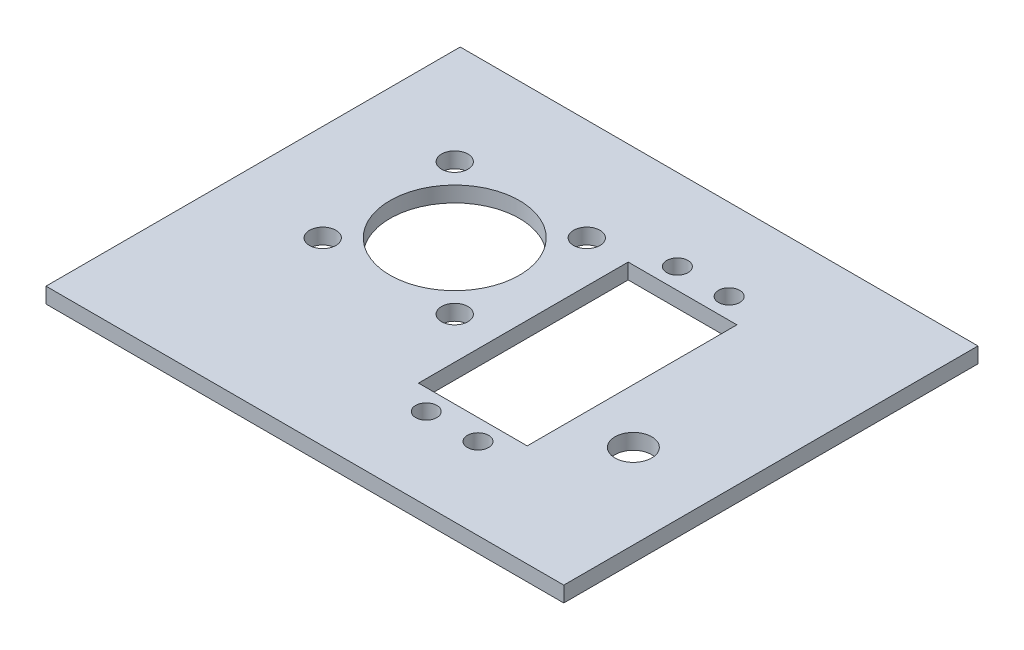
from build123d import *

# Parameters (mm, degrees)
SZKIC1_W                    = 100
SZKIC1_H                    = 80
SZKIC1_R                    = 2.55
SZKIC1_R_2                  = 2.05
SZKIC1_R_3                  = 3.55
SZKIC1_R_4                  = 12.5
SZKIC1_W_2                  = 21
SZKIC1_H_2                  = 40.5
DODANIE_WYCI_GNI_CIE1_DEPTH = 3


with BuildPart() as part:
    # Szkic1 → Dodanie-wyciągnięcie1 (new body)
    with BuildSketch(Plane(origin=(0, 0, 0), x_dir=(1, 0, 0), z_dir=(0, 1, 0))):
        with Locations((11.336719097, -8.838965942)):
            Rectangle(SZKIC1_W, SZKIC1_H)
        with Locations((-20.018770099, -14.043104788)):
            Circle(SZKIC1_R, mode=Mode.SUBTRACT)
        with Locations((5.481229901, -14.043104788)):
            Circle(SZKIC1_R, mode=Mode.SUBTRACT)
        with Locations((19.025116298, -33.088965942)):
            Circle(SZKIC1_R_2, mode=Mode.SUBTRACT)
        with Locations((29.025116298, -33.088965942)):
            Circle(SZKIC1_R_2, mode=Mode.SUBTRACT)
        with Locations((45.025116298, -19.088965942)):
            Circle(SZKIC1_R_3, mode=Mode.SUBTRACT)
        with Locations((-7.268770099, -1.293104788)):
            Circle(SZKIC1_R_4, mode=Mode.SUBTRACT)
        with Locations((-20.018770099, 11.456895212)):
            Circle(SZKIC1_R, mode=Mode.SUBTRACT)
        with Locations((5.481229901, 11.456895212)):
            Circle(SZKIC1_R, mode=Mode.SUBTRACT)
        with Locations((24.025116298, -8.838965942)):
            Rectangle(SZKIC1_W_2, SZKIC1_H_2, mode=Mode.SUBTRACT)
        with Locations((19.025116298, 15.411034058)):
            Circle(SZKIC1_R_2, mode=Mode.SUBTRACT)
        with Locations((29.025116298, 15.411034058)):
            Circle(SZKIC1_R_2, mode=Mode.SUBTRACT)
    extrude(amount=DODANIE_WYCI_GNI_CIE1_DEPTH)


solid = part.part
